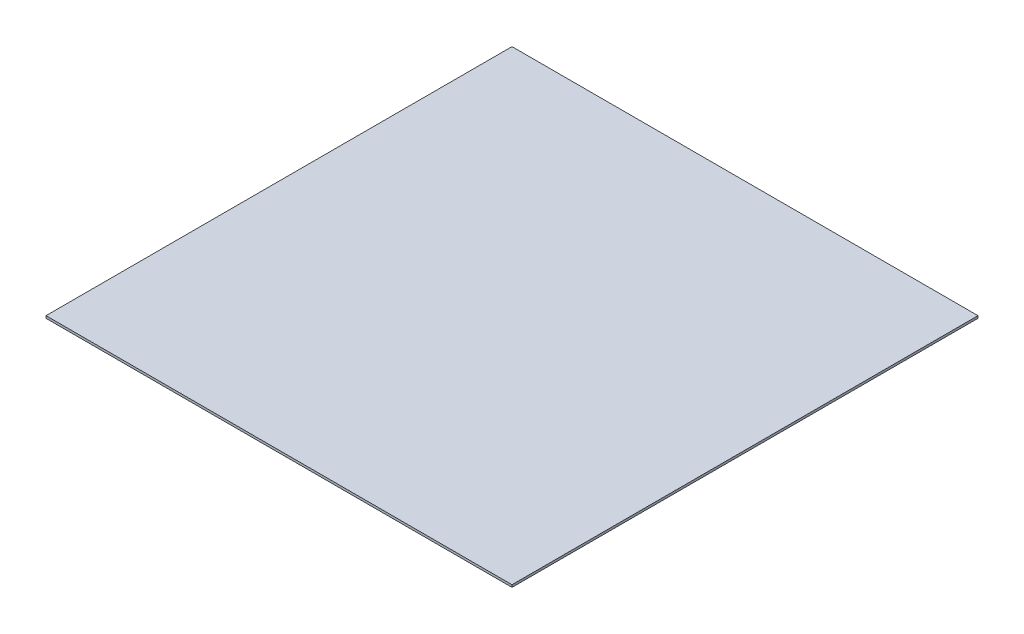
from build123d import *

# Parameters (mm, degrees)
SKETCH1_W           = 200
SKETCH1_H           = 200
BOSS_EXTRUDE1_DEPTH = 1


with BuildPart() as part:
    # Sketch1 → Boss-Extrude1 (new body)
    with BuildSketch(Plane(origin=(0, 0, 0), x_dir=(1, 0, 0), z_dir=(0, 1, 0))):
        Rectangle(SKETCH1_W, SKETCH1_H)
    extrude(amount=BOSS_EXTRUDE1_DEPTH)


solid = part.part
